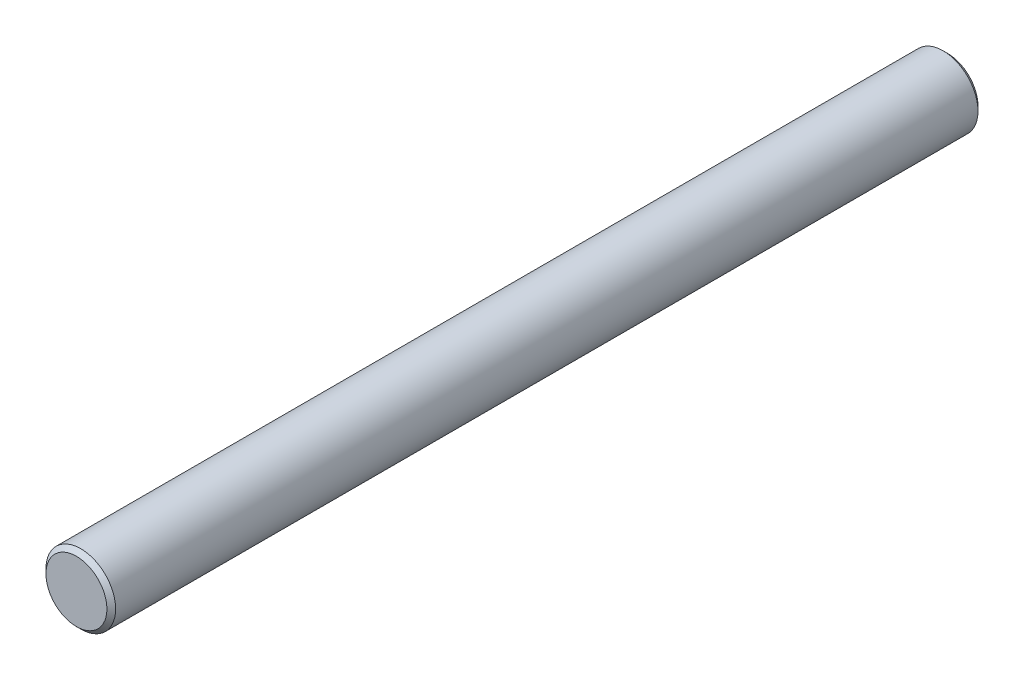
from build123d import *

# Parameters (mm, degrees)
CROQUIS1_R              = 4
SALIENTE_EXTRUIR1_DEPTH = 100
CHAFL_N1_SIZE           = 0.5


with BuildPart() as part:
    # Croquis1 → Saliente-Extruir1 (new body)
    with BuildSketch(Plane.XY):
        Circle(CROQUIS1_R)
    extrude(amount=-SALIENTE_EXTRUIR1_DEPTH)

    # Chaflán1
    chafl_n1_edges = [part.edges().sort_by_distance(p)[0] for p in [
        (-4, 0, -100),
        (-4, 0, 0),
    ]]
    chamfer(chafl_n1_edges, length=CHAFL_N1_SIZE)


solid = part.part
